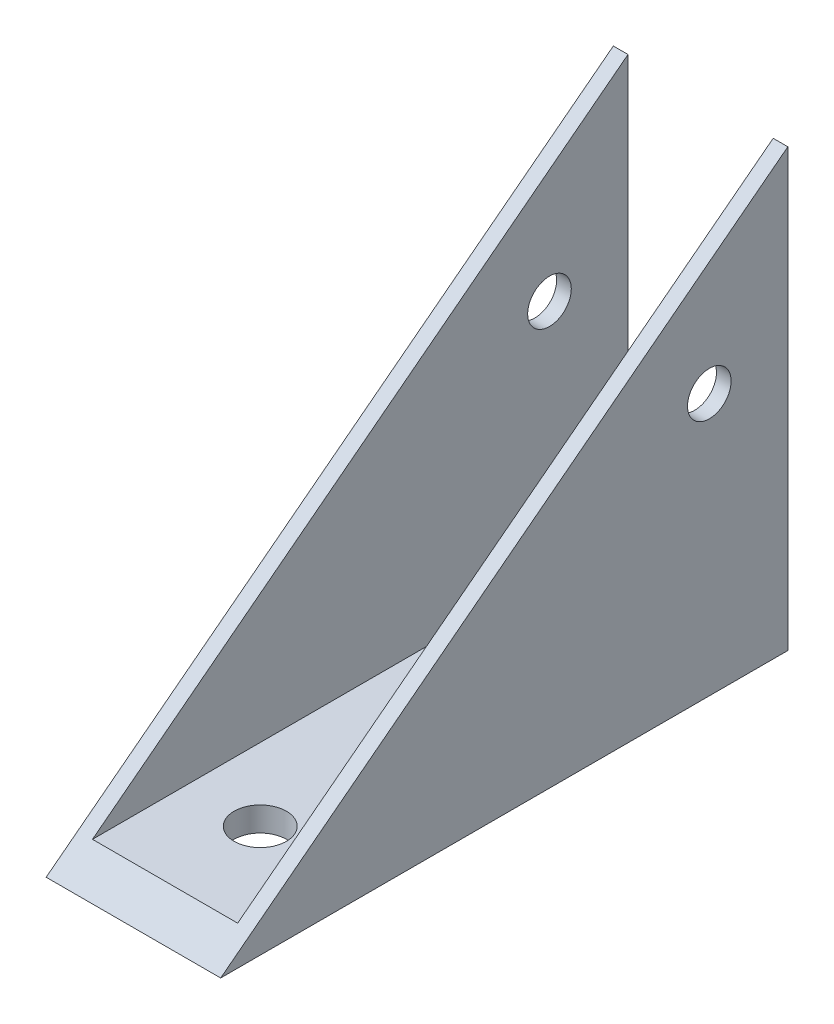
from build123d import *

# Parameters (mm, degrees)
BOSS_EXTRUDE1_DEPTH      = 10
BOSS_EXTRUDE1_DEPTH_BACK = 10
SKETCH1_R                = 2.5
SKETCH2_W                = 16.63716059
SKETCH2_H                = 50.052474656
CUT_EXTRUDE1_DEPTH       = 83.613558209
SKETCH5_R                = 2.996725581
CUT_EXTRUDE2_DEPTH       = 81.9553769


with BuildPart() as part:
    # Sketch1 → Boss-Extrude1 (new, two sides: drawn at the far end of the back side and taken through both)
    with BuildSketch(Plane(origin=(0, 0, 0), x_dir=(0, 0, -1), z_dir=(1, 0, 0)).offset(-BOSS_EXTRUDE1_DEPTH_BACK)):
        Polygon((0, 0), (65, 0), (65, 50), align=None)
        with Locations((56, 30)):
            Circle(SKETCH1_R, mode=Mode.SUBTRACT)
    extrude(amount=BOSS_EXTRUDE1_DEPTH + BOSS_EXTRUDE1_DEPTH_BACK)

    # Sketch2 → Cut-Extrude1 (cut, through all)
    with BuildSketch(Plane(origin=(0, 0, -65), x_dir=(-1, 0, 0), z_dir=(0, 0, -1))):
        with Locations((0, 27.816354368)):
            Rectangle(SKETCH2_W, SKETCH2_H)
    extrude(amount=-CUT_EXTRUDE1_DEPTH, mode=Mode.SUBTRACT)

    # Sketch5 → Cut-Extrude2 (cut, through all)
    with BuildSketch(Plane(origin=(0, 2.79011704, 0), x_dir=(1, 0, 0), z_dir=(0, 1, 0))):
        with Locations((0, 14.537718906)):
            Circle(SKETCH5_R)
        with BuildLine():
            Line((2.939338561, 68.614671895), (2.939338561, 61.385328105))
            ThreePointArc((2.939338561, 61.385328105), (0, 58.445989544), (-2.939338561, 61.385328105))
            Line((-2.939338561, 61.385328105), (-2.939338561, 68.614671895))
            ThreePointArc((-2.939338561, 68.614671895), (0, 71.554010456), (2.939338561, 68.614671895))
        make_face()
    extrude(amount=-CUT_EXTRUDE2_DEPTH, mode=Mode.SUBTRACT)


solid = part.part
